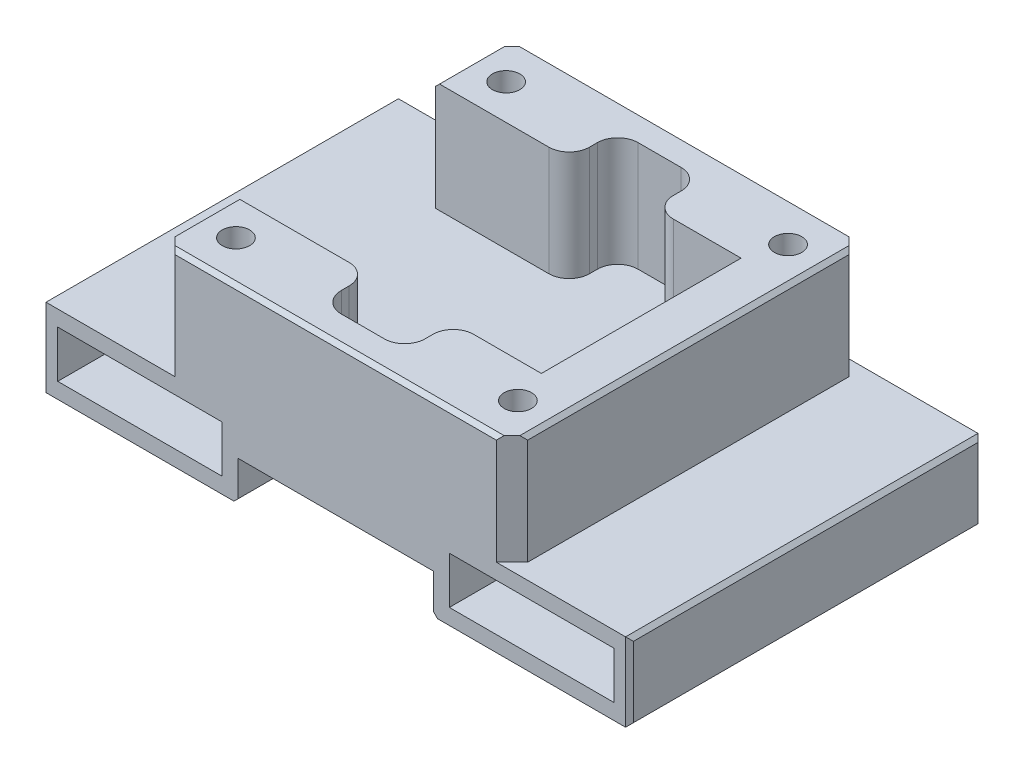
from build123d import *

# Parameters (mm, degrees)
SKETCH1_W           = 45
SKETCH1_H           = 45
BOSS_EXTRUDE1_DEPTH = 14
CUT_EXTRUDE1_DEPTH  = 35.763486592
CHAMFER1_SIZE       = 0.5
CHAMFER2_SIZE       = 2
SKETCH4_R           = 1.75
CUT_EXTRUDE2_DEPTH  = 35.763486592
SKETCH5_R           = 1.75
SKETCH5_W           = 4
SKETCH5_H           = 25.5
BOSS_EXTRUDE4_DEPTH = 5
SKETCH5_3_R         = 1.75
SKETCH5_3_W         = 4
SKETCH5_3_H         = 25.5
BOSS_EXTRUDE5_DEPTH = 10
SKETCH10_W          = 21
SKETCH10_H          = 6
CUT_EXTRUDE3_DEPTH  = 50
CHAMFER5_SIZE       = 0.5


with BuildPart() as part:
    # Sketch1 → Boss-Extrude1 (new body)
    with BuildSketch(Plane(origin=(0, 0, 0), x_dir=(1, 0, 0), z_dir=(0, 1, 0))):
        Rectangle(SKETCH1_W, SKETCH1_H)
    extrude(amount=BOSS_EXTRUDE1_DEPTH)

    # Sketch3 → Cut-Extrude1 (cut, through all)
    with BuildSketch(Plane(origin=(0, 14, 0), x_dir=(1, 0, 0), z_dir=(0, 1, 0))):
        with BuildLine():
            Line((-22.5, 12.75), (-8.05, 12.75))
            ThreePointArc((-8.05, 12.75), (-6.211522369, 13.511522369), (-5.45, 15.35))
            Line((-5.45, 15.35), (-5.45, 16.35))
            ThreePointArc((-5.45, 16.35), (-4.688477631, 18.188477631), (-2.85, 18.95))
            Line((-2.85, 18.95), (2.65, 18.95))
            ThreePointArc((2.65, 18.95), (4.488477631, 18.188477631), (5.25, 16.35))
            Line((5.25, 16.35), (5.25, 15.35))
            ThreePointArc((5.25, 15.35), (6.011522369, 13.511522369), (7.85, 12.75))
            Line((7.85, 12.75), (16.5, 12.75))
            Line((16.5, 12.75), (16.5, -12.75))
            Line((16.5, -12.75), (7.85, -12.75))
            ThreePointArc((7.85, -12.75), (6.011522369, -13.511522369), (5.25, -15.35))
            Line((5.25, -15.35), (5.25, -16.35))
            ThreePointArc((5.25, -16.35), (4.488477631, -18.188477631), (2.65, -18.95))
            Line((2.65, -18.95), (-2.85, -18.95))
            ThreePointArc((-2.85, -18.95), (-4.688477631, -18.188477631), (-5.45, -16.35))
            Line((-5.45, -16.35), (-5.45, -15.35))
            ThreePointArc((-5.45, -15.35), (-6.211522369, -13.511522369), (-8.05, -12.75))
            Line((-8.05, -12.75), (-22.5, -12.75))
            Line((-22.5, -12.75), (-22.5, 12.75))
        make_face()
    extrude(amount=-CUT_EXTRUDE1_DEPTH, mode=Mode.SUBTRACT)

    # Chamfer1
    chamfer1_edges = [part.edges().sort_by_distance(p)[0] for p in [
        (-22.5, 14, -17.625),
        (0, 14, 22.5),
        (-22.5, 14, 17.625),
        (22.5, 14, 0),
        (0, 14, -22.5),
    ]]
    chamfer(chamfer1_edges, length=CHAMFER1_SIZE)

    # Chamfer2
    # the kernel refuses this chamfer: 5.464101615, 2 mm, written as the material it takes off along each edge
    # the kernel refuses this chamfer: 5.464101615, 2 mm, written as the material it takes off along each edge
    with BuildSketch(Plane(origin=(-22.5, -5.143365976, -22.5), x_dir=(-0.027495876610585647, 0, 0.9996219169112968), z_dir=(0, 1, 0)), Plane(origin=(-22.5, -5.143365976, 22.5), x_dir=(0.9996219169112968, 0, 0.027495876610585647), z_dir=(0, 1, 0))) as chamfer2_2_piece_1:
        Polygon((CHAMFER2_SIZE * 0.999621916911, CHAMFER2_SIZE * 0.0274958766106), (-CHAMFER2_SIZE * 0.0274958766106, CHAMFER2_SIZE * 0.999621916911), (0, 0), align=None)
    extrude(amount=23.786731952, mode=Mode.SUBTRACT)
    with BuildSketch(Plane(origin=(22.5, -5.143365976, 22.5), x_dir=(-0.9996219169112968, 0, 0.027495876610585647), z_dir=(0, 1, 0)), Plane(origin=(22.5, -5.143365976, -22.5), x_dir=(0.027495876610585647, 0, 0.9996219169112968), z_dir=(0, 1, 0))) as chamfer2_2_piece_2:
        Polygon((CHAMFER2_SIZE * 0.999621916911, -CHAMFER2_SIZE * 0.0274958766106), (-CHAMFER2_SIZE * 0.0274958766106, -CHAMFER2_SIZE * 0.999621916911), (0, 0), align=None)
    extrude(amount=23.786731952, mode=Mode.SUBTRACT)

    # Sketch4 → Cut-Extrude2 (cut, through all)
    with BuildSketch(Plane(origin=(0, 14, 0), x_dir=(1, 0, 0), z_dir=(0, 1, 0))):
        with Locations(Location((-18, 17.25, 0), (0, 0, 270))):
            Circle(SKETCH4_R)
        with Locations(Location((18, 17.25, 0), (0, 0, 270))):
            Circle(SKETCH4_R)
        with Locations(Location((18, -17.25, 0), (0, 0, 270))):
            Circle(SKETCH4_R)
        with Locations(Location((-18, -17.25, 0), (0, 0, 270))):
            Circle(SKETCH4_R)
    extrude(amount=-CUT_EXTRUDE2_DEPTH, mode=Mode.SUBTRACT)

    # Sketch5 → Boss-Extrude4 (add)
    # profile 1 of 13: a face of its own
    with BuildSketch(Plane.XZ):
        Polygon((-20.5, 22.5), (-37.5, 22.5), (-37.5, -22.5), (-20.5, -22.5), (-22.5, -20.5), (-22.5, -12.75), (-12.5, -12.75), (-12.5, 12.75), (-22.5, 12.75), (-22.5, 20.5), align=None)
    # profile 2 of 13: a face of its own
    with BuildSketch(Plane.XZ):
        with BuildLine():
            Line((-8.05, 12.75), (-12.5, 12.75))
            Line((-12.5, 12.75), (-12.5, -12.75))
            Line((-12.5, -12.75), (-8.05, -12.75))
            ThreePointArc((-8.05, -12.75), (-6.211522369, -13.511522369), (-5.45, -15.35))
            Line((-5.45, -15.35), (-5.45, -16.35))
            ThreePointArc((-5.45, -16.35), (-4.688477631, -18.188477631), (-2.85, -18.95))
            Line((-2.85, -18.95), (2.65, -18.95))
            ThreePointArc((2.65, -18.95), (4.488477631, -18.188477631), (5.25, -16.35))
            Line((5.25, -16.35), (5.25, -15.35))
            ThreePointArc((5.25, -15.35), (6.011522369, -13.511522369), (7.85, -12.75))
            Line((7.85, -12.75), (12.5, -12.75))
            Line((12.5, -12.75), (12.5, 12.75))
            Line((12.5, 12.75), (7.85, 12.75))
            ThreePointArc((7.85, 12.75), (6.011522369, 13.511522369), (5.25, 15.35))
            Line((5.25, 15.35), (5.25, 16.35))
            ThreePointArc((5.25, 16.35), (4.488477631, 18.188477631), (2.65, 18.95))
            Line((2.65, 18.95), (-2.85, 18.95))
            ThreePointArc((-2.85, 18.95), (-4.688477631, 18.188477631), (-5.45, 16.35))
            Line((-5.45, 16.35), (-5.45, 15.35))
            ThreePointArc((-5.45, 15.35), (-6.211522369, 13.511522369), (-8.05, 12.75))
        make_face()
    # profile 3 of 13: a face of its own
    with BuildSketch(Plane.XZ):
        with BuildLine():
            Line((12.5, 22.5), (-12.5, 22.5))
            Line((-12.5, 22.5), (-12.5, 12.75))
            Line((-12.5, 12.75), (-8.05, 12.75))
            ThreePointArc((-8.05, 12.75), (-6.211522369, 13.511522369), (-5.45, 15.35))
            Line((-5.45, 15.35), (-5.45, 16.35))
            ThreePointArc((-5.45, 16.35), (-4.688477631, 18.188477631), (-2.85, 18.95))
            Line((-2.85, 18.95), (2.65, 18.95))
            ThreePointArc((2.65, 18.95), (4.488477631, 18.188477631), (5.25, 16.35))
            Line((5.25, 16.35), (5.25, 15.35))
            ThreePointArc((5.25, 15.35), (6.011522369, 13.511522369), (7.85, 12.75))
            Line((7.85, 12.75), (12.5, 12.75))
            Line((12.5, 12.75), (12.5, 22.5))
        make_face()
    # profile 4 of 13: a face of its own
    with BuildSketch(Plane.XZ):
        Polygon((-12.5, 22.5), (-20.5, 22.5), (-22.5, 20.5), (-22.5, 12.75), (-12.5, 12.75), align=None)
        with Locations(Location((-18, 17.25, 0), (0, 0, 90))):
            Circle(SKETCH5_R, mode=Mode.SUBTRACT)
    # profile 5 of 13: a face of its own
    with BuildSketch(Plane.XZ):
        Polygon((20.5, 22.5), (12.5, 22.5), (12.5, 12.75), (16.5, 12.75), (16.5, -12.75), (12.5, -12.75), (12.5, -22.5), (20.5, -22.5), (22.5, -20.5), (22.5, 20.5), align=None)
        with Locations(Location((18, -17.25, 0), (0, 0, 90))):
            Circle(SKETCH5_R, mode=Mode.SUBTRACT)
        with Locations(Location((18, 17.25, 0), (0, 0, 90))):
            Circle(SKETCH5_R, mode=Mode.SUBTRACT)
    # profile 6 of 13: a face of its own
    with BuildSketch(Plane.XZ):
        Polygon((37.5, 22.5), (20.5, 22.5), (22.5, 20.5), (22.5, -20.5), (20.5, -22.5), (37.5, -22.5), align=None)
    # profile 7 of 13: a face of its own
    with BuildSketch(Plane.XZ):
        with BuildLine():
            Line((-12.5, -12.75), (-12.5, -22.5))
            Line((-12.5, -22.5), (12.5, -22.5))
            Line((12.5, -22.5), (12.5, -12.75))
            Line((12.5, -12.75), (7.85, -12.75))
            ThreePointArc((7.85, -12.75), (6.011522369, -13.511522369), (5.25, -15.35))
            Line((5.25, -15.35), (5.25, -16.35))
            ThreePointArc((5.25, -16.35), (4.488477631, -18.188477631), (2.65, -18.95))
            Line((2.65, -18.95), (-2.85, -18.95))
            ThreePointArc((-2.85, -18.95), (-4.688477631, -18.188477631), (-5.45, -16.35))
            Line((-5.45, -16.35), (-5.45, -15.35))
            ThreePointArc((-5.45, -15.35), (-6.211522369, -13.511522369), (-8.05, -12.75))
            Line((-8.05, -12.75), (-12.5, -12.75))
        make_face()
    # profile 8 of 13: a face of its own
    with BuildSketch(Plane.XZ):
        Polygon((-22.5, -20.5), (-20.5, -22.5), (-12.5, -22.5), (-12.5, -12.75), (-22.5, -12.75), align=None)
        with Locations(Location((-18, -17.25, 0), (0, 0, 90))):
            Circle(SKETCH5_R, mode=Mode.SUBTRACT)
    # profile 9 of 13: a face of its own
    with BuildSketch(Plane.XZ):
        with Locations((14.5, 0)):
            Rectangle(SKETCH5_W, SKETCH5_H)
    # profile 10 of 13: a face of its own
    with BuildSketch(Plane.XZ):
        with Locations(Location((18, 17.25, 0), (0, 0, 90))):
            Circle(SKETCH5_R)
    # profile 11 of 13: a face of its own
    with BuildSketch(Plane.XZ):
        with Locations(Location((-18, 17.25, 0), (0, 0, 90))):
            Circle(SKETCH5_R)
    # profile 12 of 13: a face of its own
    with BuildSketch(Plane.XZ):
        with Locations(Location((-18, -17.25, 0), (0, 0, 90))):
            Circle(SKETCH5_R)
    # profile 13 of 13: a face of its own
    with BuildSketch(Plane.XZ):
        with Locations(Location((18, -17.25, 0), (0, 0, 90))):
            Circle(SKETCH5_R)
    extrude(amount=BOSS_EXTRUDE4_DEPTH)

    # Sketch5<3> → Boss-Extrude5 (add)
    # profile 1 of 10: a face of its own
    with BuildSketch(Plane.XZ):
        Polygon((-12.5, 22.5), (-20.5, 22.5), (-22.5, 20.5), (-22.5, 12.75), (-12.5, 12.75), align=None)
        with Locations(Location((-18, 17.25, 0), (0, 0, 90))):
            Circle(SKETCH5_3_R, mode=Mode.SUBTRACT)
    # profile 2 of 10: a face of its own
    with BuildSketch(Plane.XZ):
        Polygon((-20.5, 22.5), (-37.5, 22.5), (-37.5, -22.5), (-20.5, -22.5), (-22.5, -20.5), (-22.5, -12.75), (-12.5, -12.75), (-12.5, 12.75), (-22.5, 12.75), (-22.5, 20.5), align=None)
    # profile 3 of 10: a face of its own
    with BuildSketch(Plane.XZ):
        Polygon((-22.5, -20.5), (-20.5, -22.5), (-12.5, -22.5), (-12.5, -12.75), (-22.5, -12.75), align=None)
        with Locations(Location((-18, -17.25, 0), (0, 0, 90))):
            Circle(SKETCH5_3_R, mode=Mode.SUBTRACT)
    # profile 4 of 10: a face of its own
    with BuildSketch(Plane.XZ):
        with Locations(Location((-18, 17.25, 0), (0, 0, 90))):
            Circle(SKETCH5_3_R)
    # profile 5 of 10: a face of its own
    with BuildSketch(Plane.XZ):
        with Locations(Location((-18, -17.25, 0), (0, 0, 90))):
            Circle(SKETCH5_3_R)
    # profile 6 of 10: a face of its own
    with BuildSketch(Plane.XZ):
        Polygon((20.5, 22.5), (12.5, 22.5), (12.5, 12.75), (16.5, 12.75), (16.5, -12.75), (12.5, -12.75), (12.5, -22.5), (20.5, -22.5), (22.5, -20.5), (22.5, 20.5), align=None)
        with Locations(Location((18, -17.25, 0), (0, 0, 90))):
            Circle(SKETCH5_3_R, mode=Mode.SUBTRACT)
        with Locations(Location((18, 17.25, 0), (0, 0, 90))):
            Circle(SKETCH5_3_R, mode=Mode.SUBTRACT)
    # profile 7 of 10: a face of its own
    with BuildSketch(Plane.XZ):
        Polygon((37.5, 22.5), (20.5, 22.5), (22.5, 20.5), (22.5, -20.5), (20.5, -22.5), (37.5, -22.5), align=None)
    # profile 8 of 10: a face of its own
    with BuildSketch(Plane.XZ):
        with Locations((14.5, 0)):
            Rectangle(SKETCH5_3_W, SKETCH5_3_H)
    # profile 9 of 10: a face of its own
    with BuildSketch(Plane.XZ):
        with Locations(Location((18, 17.25, 0), (0, 0, 90))):
            Circle(SKETCH5_3_R)
    # profile 10 of 10: a face of its own
    with BuildSketch(Plane.XZ):
        with Locations(Location((18, -17.25, 0), (0, 0, 90))):
            Circle(SKETCH5_3_R)
    extrude(amount=BOSS_EXTRUDE5_DEPTH)

    # Sketch10 → Cut-Extrude3 (cut)
    with BuildSketch(Plane(origin=(0, 0, -22.5), x_dir=(-1, 0, 0), z_dir=(0, 0, -1))):
        with Locations((-25, -5)):
            Rectangle(SKETCH10_W, SKETCH10_H)
        with Locations((25, -5)):
            Rectangle(SKETCH10_W, SKETCH10_H)
    extrude(amount=-CUT_EXTRUDE3_DEPTH, mode=Mode.SUBTRACT)

    # Chamfer5
    chamfer5_edges = [part.edges().sort_by_distance(p)[0] for p in [
        (37.5, 0, 0),
        (-37.5, -5, -22.5),
        (37.5, -5, -22.5),
        (37.5, -5, 22.5),
        (-37.5, 0, 0),
        (-37.5, -5, 22.5),
        (-12.5, -10, 0),
        (-37.5, -10, 0),
        (37.5, -10, 0),
        (12.5, -10, 0),
    ]]
    chamfer(chamfer5_edges, length=CHAMFER5_SIZE)


solid = part.part
